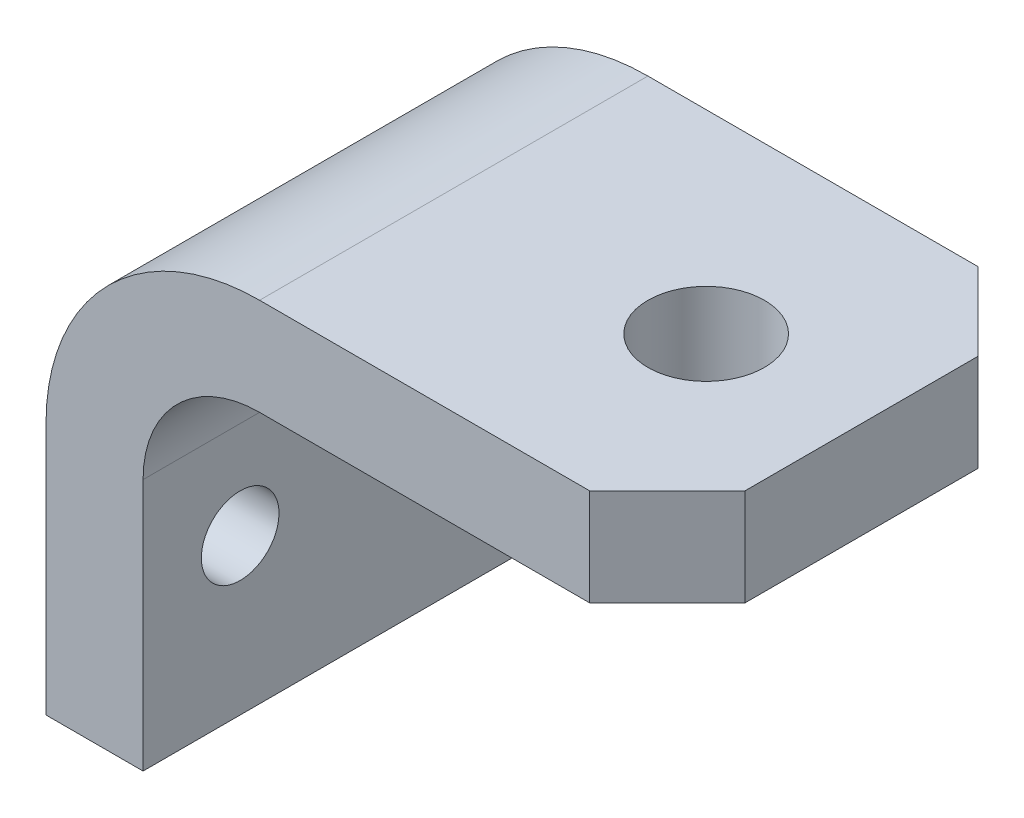
from build123d import *

# Parameters (mm, degrees)
HITCH_PROFILE_FOR_EXTRUSION_DEPTH = 31.75
SKETCH2_R                         = 9.525
BALL_ANCHOR_HOLE_DEPTH            = 113.342968182
F_45_DEG_CORNERS_DEPTH            = 113.342968182
BOLT_HOLE_X_2_REACH               = 111.526
SKETCH4_R                         = 6.35


with BuildPart() as part:
    # Sketch1 → Hitch Profile for Extrusion (new, symmetric)
    with BuildSketch(Plane.XY):
        with BuildLine():
            Line((-76.2, -60.325), (-76.2, -19.05))
            ThreePointArc((-76.2, -19.05), (-65.970704333, 5.645704333), (-41.275, 15.875))
            Line((-41.275, 15.875), (25.4, 15.875))
            Line((25.4, 15.875), (25.4, 0))
            Line((25.4, 0), (-41.275, 0))
            ThreePointArc((-41.275, 0), (-54.745384182, -5.579615818), (-60.325, -19.05))
            Line((-60.325, -19.05), (-60.325, -60.325))
            Line((-60.325, -60.325), (-76.2, -60.325))
        make_face()
    extrude(amount=HITCH_PROFILE_FOR_EXTRUSION_DEPTH, both=True)

    # Sketch2 → Ball Anchor hole (cut, through all)
    with BuildSketch(Plane(origin=(0, 15.875, 0), x_dir=(1, 0, 0), z_dir=(0, 1, 0))):
        Circle(SKETCH2_R)
    extrude(amount=-BALL_ANCHOR_HOLE_DEPTH, mode=Mode.SUBTRACT)

    # Sketch3 → 45 Deg Corners (cut, through all)
    with BuildSketch(Plane(origin=(0, 15.875, 0), x_dir=(1, 0, 0), z_dir=(0, 1, 0))):
        Polygon((12.7, 31.75), (25.4, 19.05), (25.4, 31.75), align=None)
        Polygon((12.7, -31.75), (25.4, -19.05), (25.4, -31.75), align=None)
    extrude(amount=-F_45_DEG_CORNERS_DEPTH, mode=Mode.SUBTRACT)

    # Sketch4 → Bolt Hole x 2 (cut, up to next)
    with BuildSketch(Plane(origin=(-60.325, 0, 0), x_dir=(0, 0, -1), z_dir=(1, 0, 0)), mode=Mode.PRIVATE) as bolt_hole_x_2_sk1:
        with Locations((-15.875, -34.925)):
            Circle(SKETCH4_R)
    bolt_hole_x_2_tool1 = extrude(bolt_hole_x_2_sk1.sketch, amount=-BOLT_HOLE_X_2_REACH, mode=Mode.PRIVATE) & part.part
    # Sketch4 → Bolt Hole x 2 (cut, up to next)
    with BuildSketch(Plane(origin=(-60.325, 0, 0), x_dir=(0, 0, -1), z_dir=(1, 0, 0)), mode=Mode.PRIVATE) as bolt_hole_x_2_sk2:
        with Locations((15.875, -34.925)):
            Circle(SKETCH4_R)
    bolt_hole_x_2_tool2 = extrude(bolt_hole_x_2_sk2.sketch, amount=-BOLT_HOLE_X_2_REACH, mode=Mode.PRIVATE) & part.part
    add(bolt_hole_x_2_tool1.solids().sort_by_distance((-60.325, -34.925, 15.875))[0], mode=Mode.SUBTRACT)
    add(bolt_hole_x_2_tool2.solids().sort_by_distance((-60.325, -34.925, -15.875))[0], mode=Mode.SUBTRACT)


solid = part.part
